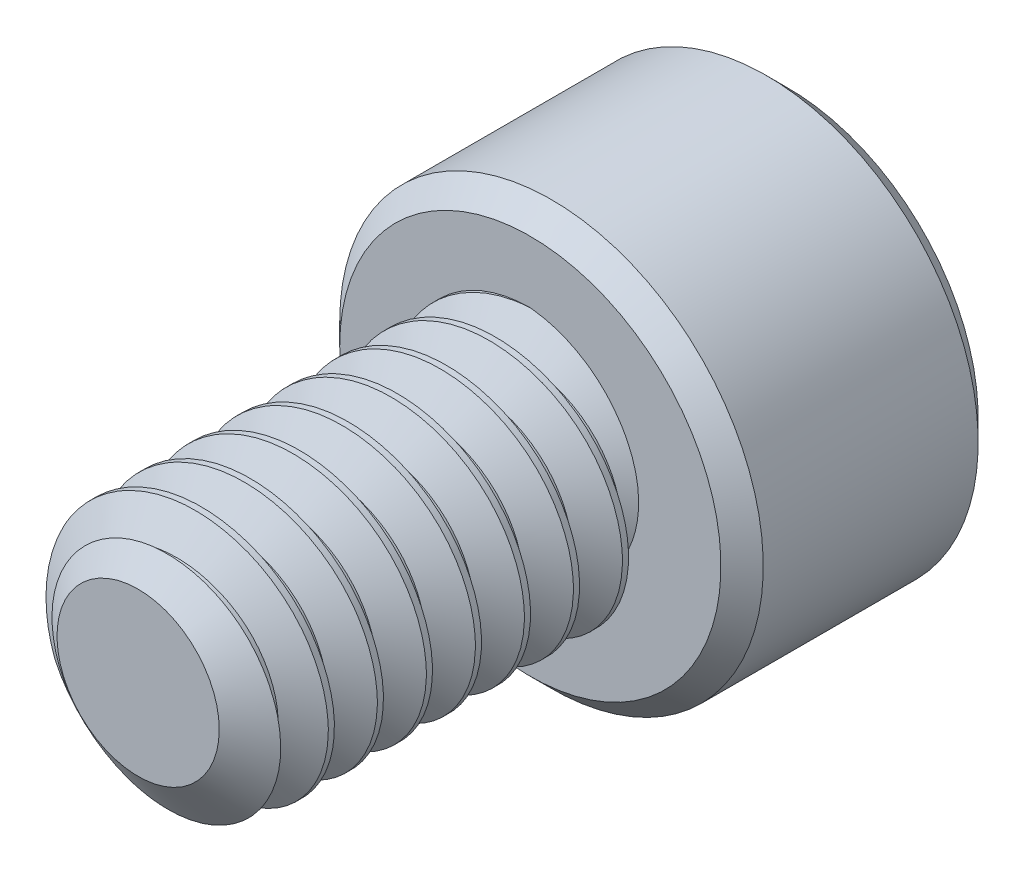
from build123d import *

# Parameters (mm, degrees)
SKETCH1_R          = 2.0828
EXTRUDE1_DEPTH     = 6.35
CUT_SWEEP1_PITCH   = 0.79375
SKETCH6_R          = 3.429
EXTRUDE2_DEPTH     = 4.1656
CUT_EXTRUDE1_DEPTH = 2.67890625
CHAMFER1_SIZE      = 0.3429


with BuildPart() as part:
    # Sketch1 → Extrude1 (new body)
    with BuildSketch(Plane.XY):
        Circle(SKETCH1_R)
    extrude(amount=-EXTRUDE1_DEPTH)

    # Cut-Sweep1: the profile of Sketch3 profile screwed along a right-hand helix of 9 turns, 6 arcs to a turn; built about Z, then put on its axis
    cut_sweep1_z = Axis((0, 0, 0), (0, 0, 1))
    cut_sweep1_corners = [(2.0831, 0, -0.694704455), (1.567244252, 0, -0.396875), (1.567244252, 0, -0.29765625), (2.0831, 0, 0.000173205)]
    with BuildLine(mode=Mode.PRIVATE) as cut_sweep1_profile:
        Line(cut_sweep1_corners[0], cut_sweep1_corners[1])
        Line(cut_sweep1_corners[1], cut_sweep1_corners[2])
        Line(cut_sweep1_corners[2], cut_sweep1_corners[3])
        Line(cut_sweep1_corners[3], cut_sweep1_corners[0])
    cut_sweep1_cap = Face(cut_sweep1_profile.wire())
    cut_sweep1_turn_angles = [0, 30, 60, 90, 120, 150, 180, 210, 240, 270, 300, 330, 360]
    cut_sweep1_turn_weights = [1, 0.8660254037844387, 1, 0.8660254037844387, 1, 0.8660254037844387, 1, 0.8660254037844387, 1, 0.8660254037844387, 1, 0.8660254037844387, 1]
    cut_sweep1_turn_rails = [Edge.make_bspline([Vector(p[0], p[1], 0).rotate(cut_sweep1_z, cut_sweep1_turn_angles[k]) / cut_sweep1_turn_weights[k] + Vector(0, 0, p[2] + CUT_SWEEP1_PITCH * cut_sweep1_turn_angles[k] / 360) for k in range(13)], [0, 0, 0, 1, 1, 2, 2, 3, 3, 4, 4, 5, 5, 6, 6, 6], 2, cut_sweep1_turn_weights) for p in cut_sweep1_corners]
    cut_sweep1_turn_sides = [Face.make_surface_from_curves(cut_sweep1_turn_rails[p[0]], cut_sweep1_turn_rails[p[1]]) for p in [(0, 1), (1, 2), (2, 3), (3, 0)]]
    cut_sweep1 = Plane(origin=(0, 0, 0), x_dir=(0, 1, 0), z_dir=(0, 0, -1)) * Solid(Shell([*[p.moved(Location((0, 0, CUT_SWEEP1_PITCH * i))) for i in range(9) for p in cut_sweep1_turn_sides], cut_sweep1_cap, cut_sweep1_cap.rotate(cut_sweep1_z, 3240).moved(Location((0, 0, CUT_SWEEP1_PITCH * 3240 / 360)))]))
    add(cut_sweep1, mode=Mode.SUBTRACT)

    # Sketch4 → Cut-Revolve1 (revolve, cut)
    with BuildSketch(Plane(origin=(0, 0, 0), x_dir=(0, 0, -1), z_dir=(1, 0, 0)), mode=Mode.PRIVATE) as cut_revolve1_sk:
        Polygon((0.538848736, 2.0828), (0, 1.313244252), (0, 2.0828), align=None)
    revolve(cut_revolve1_sk.sketch.rotate(Axis((0, 0, 0), (0, 0, -1)), 261.048315518), axis=Axis((0, 0, 0), (0, 0, -1)), mode=Mode.SUBTRACT)

    # Sketch6 → Extrude2 (add)
    with BuildSketch(Plane(origin=(0, 0, -6.35), x_dir=(-1, 0, 0), z_dir=(0, 0, -1))):
        Circle(SKETCH6_R)
    extrude(amount=EXTRUDE2_DEPTH)

    # Sketch7 → Cut-Extrude1 (cut)
    with BuildSketch(Plane(origin=(0, 0, -10.5156), x_dir=(-1, 0, 0), z_dir=(0, 0, -1))):
        Polygon((0, 2.062222993), (-1.7859375, 1.031111496), (-1.7859375, -1.031111496), (0, -2.062222993), (1.7859375, -1.031111496), (1.7859375, 1.031111496), align=None)
    extrude(amount=-CUT_EXTRUDE1_DEPTH, mode=Mode.SUBTRACT)

    # Cut-Extrude2 cone 1 section (through the dimple's axis) → Cut-Extrude2 (revolve, cut)
    with BuildSketch(Plane(origin=(0, 0, -10.5156), x_dir=(0, 1, 0), z_dir=(1, 0, 0))):
        Polygon((0, 0), (2.062222993, 0), (0, 2.062222993), align=None)
    revolve(axis=Axis((0, 0, -10.5156), (0, 0, 1)), mode=Mode.SUBTRACT)

    # Chamfer1
    chamfer1_edges = [part.edges().sort_by_distance(p)[0] for p in [
        (3.429, 0, -6.35),
        (3.429, 0, -10.5156),
    ]]
    chamfer(chamfer1_edges, length=CHAMFER1_SIZE)


solid = part.part
